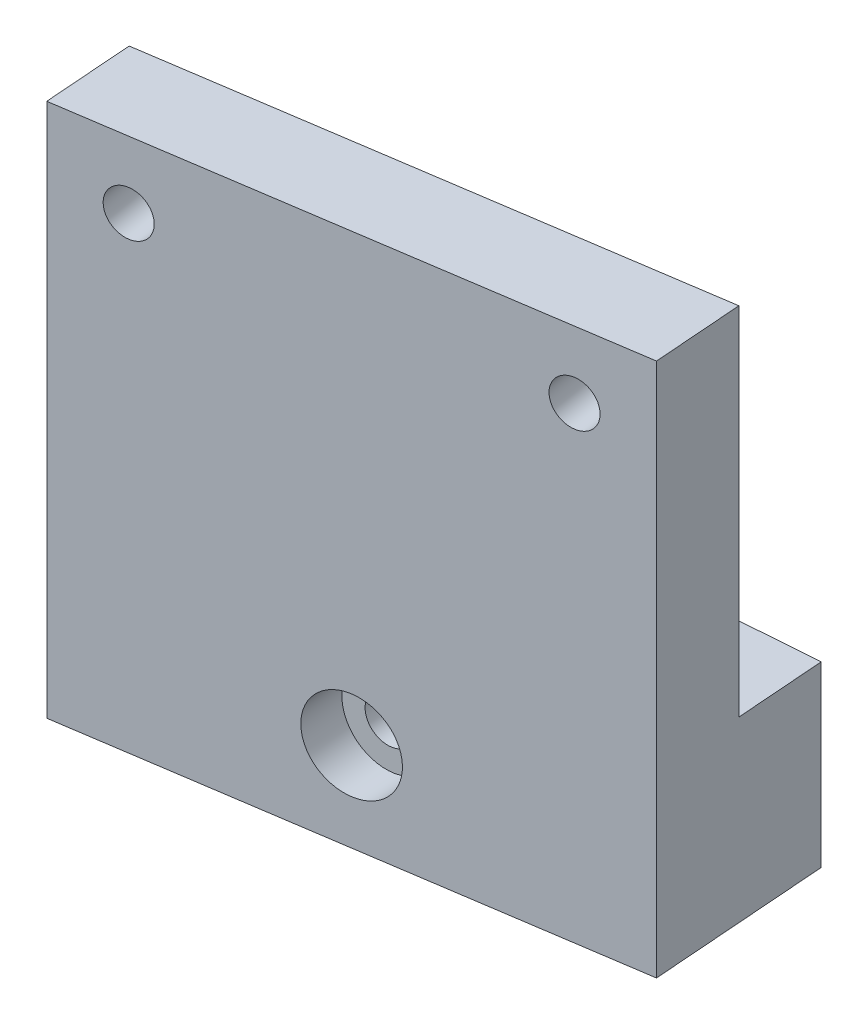
from build123d import *

# Parameters (mm, degrees)
BOSS_EXTRUDE1_OUTLINE_W   = 76.2
BOSS_EXTRUDE1_OUTLINE_H   = 25.4
BOSS_EXTRUDE1_OUTLINE_R   = 3.2639
BOSS_EXTRUDE1_DEPTH       = 25.471337323
BOSS_EXTRUDE1_START       = -25.4
BOSS_EXTRUDE1_2_DEPTH     = 25.4
BOSS_EXTRUDE1_START_2     = 333.890252769
BOSS_EXTRUDE1_3_OUTLINE_R = 3.2639
BOSS_EXTRUDE1_3_DEPTH     = 5.715
BOSS_EXTRUDE2_START       = 302.068915446
BOSS_EXTRUDE2_OUTLINE_R   = 2.3622
BOSS_EXTRUDE2_DEPTH       = 6.931084554
BOSS_EXTRUDE3_DEPTH       = 50.8
SKETCH6_R                 = 3.19999995
CUT_EXTRUDE1_DEPTH        = 120.033223303
SKETCH8_R                 = 6.35
CUT_EXTRUDE2_DEPTH        = 6.35


with BuildPart() as part:
    # Boss-Extrude1: read off the stored shape, not the designer's step
    # Boss-Extrude1 outline → Boss-Extrude1 (new body)
    with BuildSketch(Plane(origin=(23.066634723, 0, 307.55512964), x_dir=(0.9971993098884564, 0, -0.07478994824163422), z_dir=(0.07478994824163422, 0, 0.9971993098884564))):
        with Locations((38.1, -12.7)):
            Rectangle(BOSS_EXTRUDE1_OUTLINE_W, BOSS_EXTRUDE1_OUTLINE_H)
        with Locations((38.1, -12.701750828)):
            Circle(BOSS_EXTRUDE1_OUTLINE_R, mode=Mode.SUBTRACT)
    extrude(amount=BOSS_EXTRUDE1_DEPTH)

    # Boss-Extrude1 2 outline → Boss-Extrude1 2 (add)
    with BuildSketch(Plane(origin=(0, 0, 0), x_dir=(1, 0, 0), z_dir=(0, 1, 0)).offset(BOSS_EXTRUDE1_START)):
        Polygon((101.385646691, -332.95512964), (100.958222137, -327.256135584), (24.971634723, -332.95512964), align=None)
    extrude(amount=BOSS_EXTRUDE1_2_DEPTH)

    # Boss-Extrude1 3 outline → Boss-Extrude1 3 (cut)
    with BuildSketch(Plane(origin=(0, 0, 0), x_dir=(0.9971993098884564, 0, -0.07478994824163422), z_dir=(0.07478994824163422, 0, 0.9971993098884564)).offset(BOSS_EXTRUDE1_START_2)):
        with Locations((38.1, -12.701750828)):
            Circle(BOSS_EXTRUDE1_3_OUTLINE_R)
    extrude(amount=BOSS_EXTRUDE1_3_DEPTH, mode=Mode.SUBTRACT)

    # Boss-Extrude2: read off the stored shape, not the designer's step
    # Boss-Extrude2 outline → Boss-Extrude2 (add)
    with BuildSketch(Plane(origin=(0, 0, 0), x_dir=(0.9971993098884564, 0, -0.07478994824163422), z_dir=(0.07478994824163422, 0, 0.9971993098884564)).offset(BOSS_EXTRUDE2_START)):
        with Locations((57.15, -12.701750828)):
            Circle(BOSS_EXTRUDE2_OUTLINE_R)
        with Locations((19.05, -12.701750828)):
            Circle(BOSS_EXTRUDE2_OUTLINE_R)
    extrude(amount=BOSS_EXTRUDE2_DEPTH)

    # Sketch7 → Boss-Extrude3 (add)
    with BuildSketch(Plane(origin=(0, 0, 0), x_dir=(1, 0, 0), z_dir=(0, 1, 0))):
        Polygon((24.971634723, -332.95512964), (24.019134723, -320.25512964), (100.433146691, -320.25512964), (101.385646691, -332.95512964), align=None)
    extrude(amount=BOSS_EXTRUDE3_DEPTH)

    # Sketch6 → Cut-Extrude1 (cut, through all)
    with BuildSketch(Plane.XY.offset(332.95512964)):
        with Locations((35.238640707, 41.275)):
            Circle(SKETCH6_R)
        with Locations((91.118640707, 41.275)):
            Circle(SKETCH6_R)
    extrude(amount=-CUT_EXTRUDE1_DEPTH, mode=Mode.SUBTRACT)

    # Sketch8 → Cut-Extrude2 (cut)
    with BuildSketch(Plane(origin=(25.220865956, 0, 336.278212746), x_dir=(-0.9971993098884564, 0, 0.07478994824163424), z_dir=(-0.07478994824163424, 0, -0.9971993098884564))):
        with Locations(Location((-38.1, -12.701750828, 0), (0, 0, 175.710846671))):
            Circle(SKETCH8_R)
    extrude(amount=CUT_EXTRUDE2_DEPTH, mode=Mode.SUBTRACT)


with BuildPart() as body_2:
    # Mirror1: mirrored copy
    add(part.part.mirror(Plane(origin=(107.187637483, 0, 410.315006871), x_dir=(0.07478994824163424, 0, 0.9971993098884564), z_dir=(-0.9971993098884564, 1.0351948349208248e-14, 0.07478994824163424))))


solid = body_2.part
